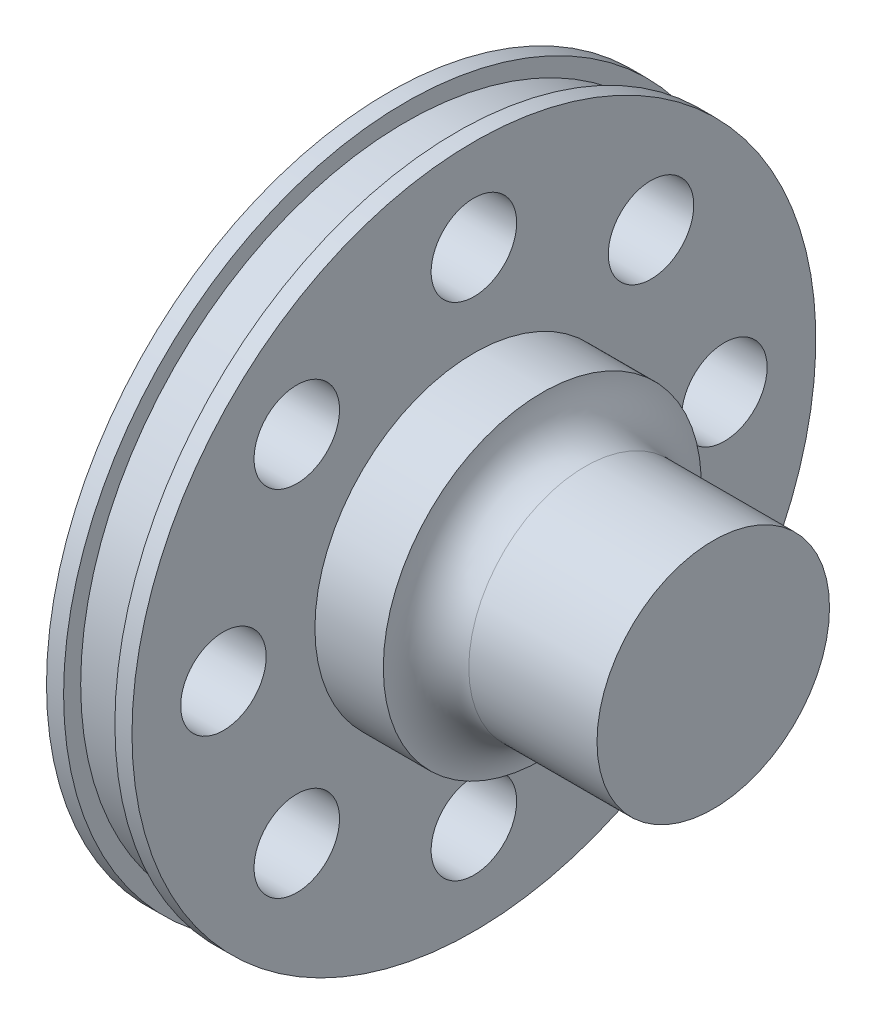
from build123d import *

# Parameters (mm, degrees)
SKETCH3_R          = 6.35
CUT_EXTRUDE1_DEPTH = 81.161047897
FILLET1_R          = 6.35


with BuildPart() as part:
    # Sketch2 → Revolve1 (revolve)
    with BuildSketch(Plane.XY, mode=Mode.PRIVATE) as revolve1_sk:
        Polygon((45.72, 17.272), (20.32, 17.272), (20.32, 23.622), (10.16, 23.622), (10.16, 50.8), (7.62, 50.8), (7.62, 48.26), (0, 48.26), (0, 50.8), (-2.54, 50.8), (-2.54, 12.7), (0, 12.7), (0, 0), (45.72, 0), align=None)
    revolve(revolve1_sk.sketch.rotate(Axis((-1001.184765233, 0, 0), (1, 0, 0)), 90), axis=Axis((-1001.184765233, 0, 0), (1, 0, 0)))

    # Sketch3 → Cut-Extrude1 (cut, through all)
    with BuildSketch(Plane(origin=(10.16, 0, 0), x_dir=(0, 0, -1), z_dir=(1, 0, 0))):
        with Locations((26.312150435, 26.312150435)):
            Circle(SKETCH3_R)
        with Locations((0, 37.211)):
            Circle(SKETCH3_R)
        with Locations((37.211, 0)):
            Circle(SKETCH3_R)
        with Locations((26.312150435, -26.312150435)):
            Circle(SKETCH3_R)
        with Locations((0, -37.211)):
            Circle(SKETCH3_R)
        with Locations((-26.312150435, -26.312150435)):
            Circle(SKETCH3_R)
        with Locations((-37.211, 0)):
            Circle(SKETCH3_R)
        with Locations((-26.312150435, 26.312150435)):
            Circle(SKETCH3_R)
    extrude(amount=-CUT_EXTRUDE1_DEPTH, mode=Mode.SUBTRACT)

    # Fillet1
    fillet1_edges = [part.edges().sort_by_distance(p)[0] for p in [
        (20.32, 0, -17.272),
    ]]
    fillet(fillet1_edges, radius=FILLET1_R - 0.0001)  # a hair under: the kernel refuses the full size


solid = part.part
